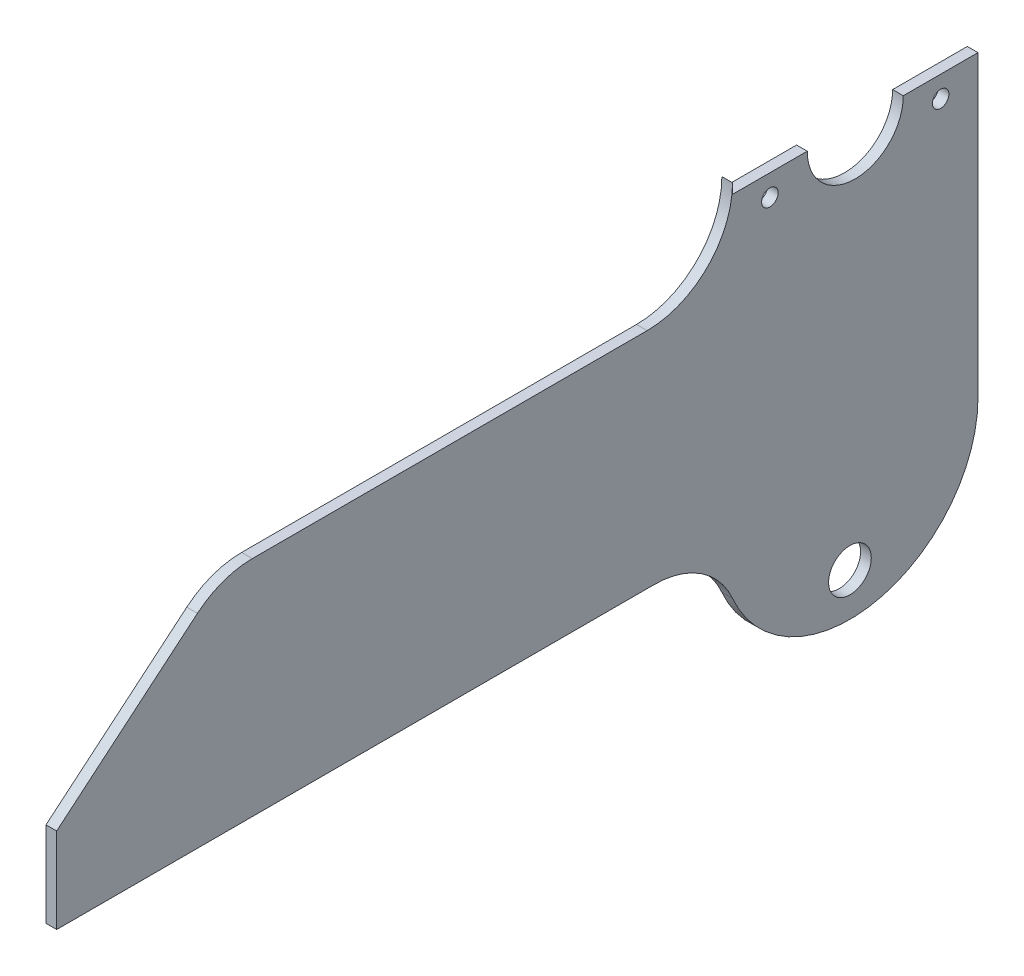
from build123d import *

# Parameters (mm, degrees)
BOSS_EXTRUDE1_DEPTH          = 3.175
F_10_0_1935_DIAMETER_HOLE1_D = 4.9149
SKETCH4_R                    = 6.35
CUT_EXTRUDE1_DEPTH           = 287.283832011


with BuildPart() as part:
    # Sketch1 → Boss-Extrude1 (new body)
    with BuildSketch(Plane(origin=(0, 0, 0), x_dir=(0, 0, -1), z_dir=(1, 0, 0))):
        with BuildLine():
            Line((0, -44.45), (0, 44.45))
            Line((0, 44.45), (-22.225, 44.45))
            ThreePointArc((-22.225, 44.45), (-36.5125, 30.1625), (-50.8, 44.45))
            Line((-50.8, 44.45), (-73.025, 44.45))
            Line((-73.025, 44.45), (-73.025, 47.4321837))
            ThreePointArc((-73.025, 47.4321837), (-80.464487758, 29.471671458), (-98.425, 22.0321837))
            Line((-98.425, 22.0321837), (-215.9, 22.0321837))
            ThreePointArc((-215.9, 22.0321837), (-224.58731164, 20.500376268), (-232.226805286, 16.089712555))
            Line((-232.226805286, 16.089712555), (-274.104683967, -19.05))
            Line((-274.104683967, -19.05), (-274.104683967, -44.45))
            Line((-274.104683967, -44.45), (-96.304683967, -44.45))
            ThreePointArc((-96.304683967, -44.45), (-82.392322427, -48.598971875), (-73.025, -59.690456978))
            ThreePointArc((-73.025, -59.690456978), (-30.318441349, -81.74920292), (0, -44.45))
        make_face()
    extrude(amount=BOSS_EXTRUDE1_DEPTH)

    # #10 (0.1935) Diameter Hole1 (through all)
    with Locations(Plane(origin=(3.175, 0, 0), x_dir=(0, 0, -1), z_dir=(1, 0, 0))):
        with Locations((-61.9125, 38.1), (-11.1125, 38.1)):
            Hole(F_10_0_1935_DIAMETER_HOLE1_D / 2)

    # Sketch4 → Cut-Extrude1 (cut, through all)
    with BuildSketch(Plane(origin=(3.175, 0, 0), x_dir=(0, 0, -1), z_dir=(1, 0, 0))):
        with Locations((-38.10285624, -69.85)):
            Circle(SKETCH4_R)
    extrude(amount=-CUT_EXTRUDE1_DEPTH, mode=Mode.SUBTRACT)


solid = part.part
